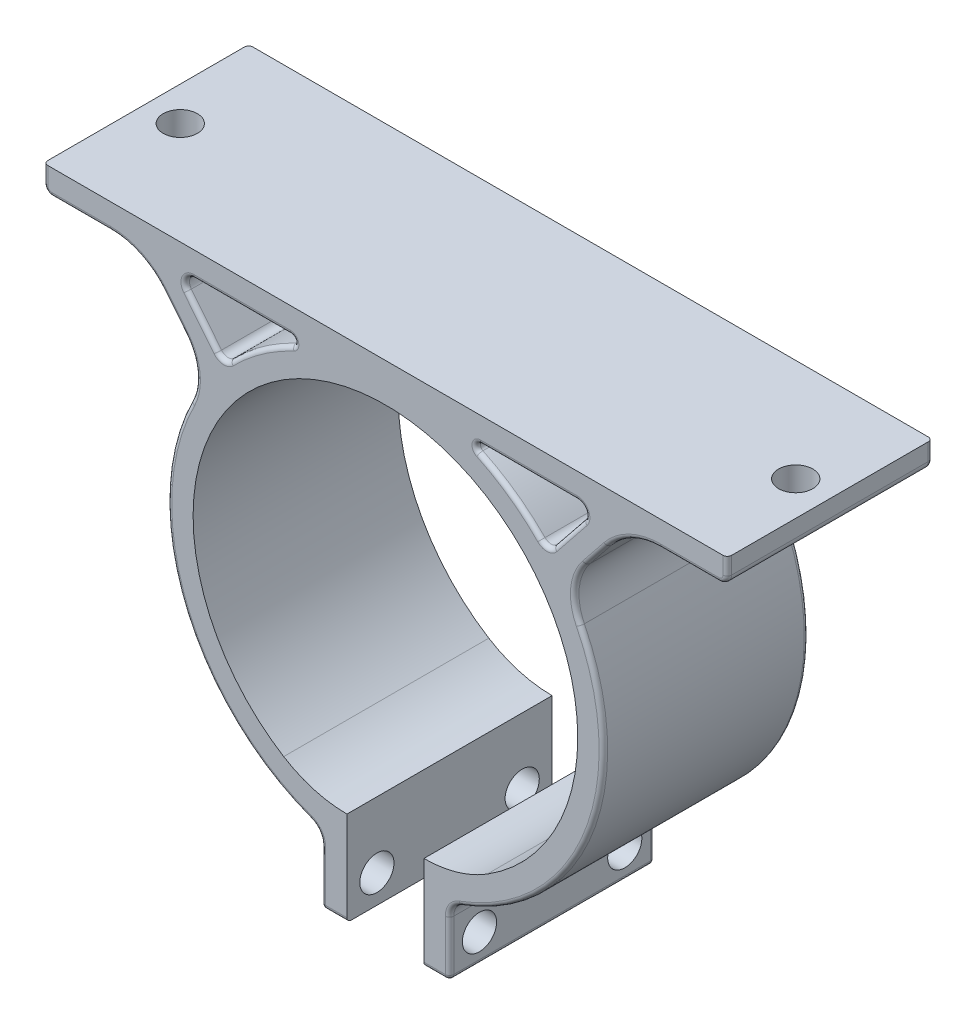
from build123d import *

# Parameters (mm, degrees)
SKIZZE1_R                       = 25.5
SKIZZE1_R_2                     = 22.5
AUFSATZ_LINEAR_AUSTRAGEN1_DEPTH = 24
SKIZZE2_W                       = 15
SKIZZE2_H                       = 10
SCHNITT_LINEAR_AUSTRAGEN3_DEPTH = 25
SKIZZE5_W                       = 80
SKIZZE5_H                       = 3
AUFSATZ_LINEAR_AUSTRAGEN2_DEPTH = 24
SKIZZE6_W                       = 3
SKIZZE6_H                       = 11
AUFSATZ_LINEAR_AUSTRAGEN3_DEPTH = 24
AUFSATZ_LINEAR_AUSTRAGEN4_DEPTH = 24
VERRUNDUNG3_R                   = 6
VERRUNDUNG4_R                   = 1
VERRUNDUNG5_R                   = 1
VERRUNDUNG6_R                   = 0.5
VERRUNDUNG11_R                  = 14
VERRUNDUNG12_R                  = 2
VERRUNDUNG13_R                  = 1
SKIZZE11_R                      = 2
SCHNITT_LINEAR_AUSTRAGEN4_DEPTH = 20
SKIZZE12_R                      = 2
SCHNITT_LINEAR_AUSTRAGEN5_DEPTH = 22
VERRUNDUNG14_R                  = 0.5
VERRUNDUNG15_R                  = 8
VERRUNDUNG16_R                  = 0.5
VERRUNDUNG17_R                  = 0.5


with BuildPart() as part:
    # Skizze1 → Aufsatz-Linear austragen1 (new body)
    with BuildSketch(Plane.XY.offset(10)):
        Circle(SKIZZE1_R)
        Circle(SKIZZE1_R_2, mode=Mode.SUBTRACT)
    extrude(amount=AUFSATZ_LINEAR_AUSTRAGEN1_DEPTH)

    # Skizze2 → Schnitt-Linear austragen3 (cut)
    with BuildSketch(Plane.XY.offset(10)):
        with Locations((0, -23.935185079)):
            Rectangle(SKIZZE2_W, SKIZZE2_H)
    extrude(amount=SCHNITT_LINEAR_AUSTRAGEN3_DEPTH, mode=Mode.SUBTRACT)

    # Skizze5 → Aufsatz-Linear austragen2 (add)
    with BuildSketch(Plane.XY.offset(10)):
        with Locations((0, 25.5)):
            Rectangle(SKIZZE5_W, SKIZZE5_H)
    extrude(amount=AUFSATZ_LINEAR_AUSTRAGEN2_DEPTH)

    # Skizze6 → Aufsatz-Linear austragen3 (add)
    with BuildSketch(Plane.XY.offset(10)):
        with Locations((6, -26.713203436)):
            Rectangle(SKIZZE6_W, SKIZZE6_H)
        with Locations((-6, -26.713203436)):
            Rectangle(SKIZZE6_W, SKIZZE6_H)
    extrude(amount=AUFSATZ_LINEAR_AUSTRAGEN3_DEPTH)

    # Skizze10 → Aufsatz-Linear austragen4 (add)
    with BuildSketch(Plane.XY.offset(10)):
        with BuildLine():
            Line((28.345283417, 24), (20.864493302, 14.660249631))
            ThreePointArc((20.864493302, 14.660249631), (18.945102255, 15.097259463), (18.947545893, 17.065769969))
            Line((18.947545893, 17.065769969), (24.501604344, 24))
            Line((24.501604344, 24), (28.345283417, 24))
        make_face()
        with BuildLine():
            Line((-24.501604344, 24), (-18.947545893, 17.065769969))
            ThreePointArc((-18.947545893, 17.065769969), (-18.945102255, 15.097259463), (-20.864493302, 14.660249631))
            Line((-20.864493302, 14.660249631), (-28.345283417, 24))
            Line((-28.345283417, 24), (-24.501604344, 24))
        make_face()
    extrude(amount=AUFSATZ_LINEAR_AUSTRAGEN4_DEPTH)

    # Verrundung3
    verrundung3_edges = [part.edges().sort_by_distance(p)[0] for p in [
        (-20.864493302, 14.660249631, 22),
        (20.864493302, 14.660249631, 22),
    ]]
    fillet(verrundung3_edges, radius=VERRUNDUNG3_R)

    # Verrundung4
    verrundung4_edges = [part.edges().sort_by_distance(p)[0] for p in [
        (-18.947545893, 17.065769969, 22),
        (18.947545893, 17.065769969, 22),
    ]]
    fillet(verrundung4_edges, radius=VERRUNDUNG4_R)

    # Verrundung5
    verrundung5_edges = [part.edges().sort_by_distance(p)[0] for p in [
        (-24.501604344, 24, 22),
        (24.501604344, 24, 22),
    ]]
    fillet(verrundung5_edges, radius=VERRUNDUNG5_R)

    # Verrundung6
    verrundung6_edges = [part.edges().sort_by_distance(p)[0] for p in [
        (-8.61684397, 24, 22),
        (8.61684397, 24, 22),
    ]]
    fillet(verrundung6_edges, radius=VERRUNDUNG6_R)

    # Verrundung11
    # the kernel refuses this fillet: 14 mm, written as the material it adds along each edge
    with BuildSketch(Plane(origin=(-7.5, -21.213203436, 34), x_dir=(-0.9010385119432196, 0.43373909207627176, 0), z_dir=(0, 0, -1))) as verrundung11_piece_1:
        with BuildLine():
            CenterArc((3.366195979, 13.917217345), VERRUNDUNG11_R, 244.308700365, 31.925166456)
            Line((-2.703115536, 1.301217276), (-2.824501766, 1.048897275))
            Line((-2.824501766, 1.048897275), (-0.121446946, -0.252290783))
            Line((-0.121446946, -0.252290783), (-0.030404351, -0.278344347))
            ThreePointArc((-0.030404351, -0.278344347), (2.443206759, -0.413043552), (4.916817868, -0.278344347))
            Line((4.916817868, -0.278344347), (4.886413517, 0))
        make_face()
    extrude(amount=24)
    with BuildSketch(Plane(origin=(7.5, -21.213203436, 34), x_dir=(-1, 0, 0), z_dir=(0, 0, -1))) as verrundung11_piece_2:
        with BuildLine():
            CenterArc((3.003369, 13.999999595), VERRUNDUNG11_R, 238.061045723, 31.925166456)
            Line((-4.402846764, 2.119428562), (-4.55097108, 1.881817142))
            ThreePointArc((-4.55097108, 1.881817142), (-2.380576517, 0.687546134), (-0.093333333, -0.263986532))
            Line((-0.093333333, -0.263986532), (0, -0.28))
            Line((0, -0.28), (2.99993262, -0.279999992))
            Line((2.99993262, -0.279999992), (3, 0))
        make_face()
    extrude(amount=24)

    # Verrundung12
    verrundung12_edges = [part.edges().sort_by_distance(p)[0] for p in [
        (-7.5, -24.372115214, 22),
        (7.5, -24.372115214, 22),
    ]]
    fillet(verrundung12_edges, radius=VERRUNDUNG12_R)

    # Verrundung13
    verrundung13_edges = [part.edges().sort_by_distance(p)[0] for p in [
        (-40, 24, 22),
        (40, 24, 22),
    ]]
    fillet(verrundung13_edges, radius=VERRUNDUNG13_R)

    # Skizze11 → Schnitt-Linear austragen4 (cut)
    with BuildSketch(Plane(origin=(0, 27, 0), x_dir=(1, 0, 0), z_dir=(0, 1, 0))):
        with Locations(Location((36, -22, 0), (0, 0, 180))):
            Circle(SKIZZE11_R)
        with Locations(Location((-36, -22, 0), (0, 0, 180))):
            Circle(SKIZZE11_R)
    extrude(amount=-SCHNITT_LINEAR_AUSTRAGEN4_DEPTH, mode=Mode.SUBTRACT)

    # Skizze12 → Schnitt-Linear austragen5 (cut)
    with BuildSketch(Plane.ZY.offset(7.5)):
        with Locations((13.5, -28.913203436)):
            Circle(SKIZZE12_R)
        with Locations((30.5, -28.913203436)):
            Circle(SKIZZE12_R)
    extrude(amount=-SCHNITT_LINEAR_AUSTRAGEN5_DEPTH, mode=Mode.SUBTRACT)

    # Verrundung14
    verrundung14_edges = [part.edges().sort_by_distance(p)[0] for p in [
        (7.5, -32.213203436, 22),
        (-7.5, -32.213203436, 22),
    ]]
    fillet(verrundung14_edges, radius=VERRUNDUNG14_R)

    # Verrundung15
    verrundung15_edges = [part.edges().sort_by_distance(p)[0] for p in [
        (-28.345283417, 24, 22),
        (28.345283417, 24, 22),
    ]]
    fillet(verrundung15_edges, radius=VERRUNDUNG15_R)

    # Verrundung16
    verrundung16_edges = [part.edges().sort_by_distance(p)[0] for p in [
        (-23.717650268, -9.366059244, 10),
        (-23.717650268, -9.366059244, 34),
        (24.701707347, 19.451003113, 10),
        (24.701707347, 19.451003113, 34),
        (-22.175925253, 14.777082644, 10),
        (-22.175925253, 14.777082644, 34),
        (22.175925253, 14.777082644, 10),
        (22.175925253, 14.777082644, 34),
        (-7.5, -28.760089618, 34),
        (-7.5, -28.760089618, 10),
        (23.717650268, -9.366059244, 10),
        (23.717650268, -9.366059244, 34),
        (-7.859600935, -24.662820694, 10),
        (-7.859600935, -24.662820694, 34),
        (7.859600935, -24.662820694, 34),
        (7.859600935, -24.662820694, 10),
        (-35.593697006, 24, 34),
        (-35.593697006, 24, 10),
        (40, 26, 10),
        (39.707106781, 24.292893219, 10),
        (-39.707106781, 24.292893219, 10),
        (40, 26, 34),
        (39.707106781, 24.292893219, 34),
        (-39.707106781, 24.292893219, 34),
        (-5.75, -32.213203436, 10),
        (-5.75, -32.213203436, 34),
        (7.5, -28.760089618, 10),
        (7.353553391, -32.066756826, 10),
        (-7.353553391, -32.066756826, 10),
        (7.5, -28.760089618, 34),
        (7.353553391, -32.066756826, 34),
        (-7.353553391, -32.066756826, 34),
        (35.593697006, 24, 10),
        (35.593697006, 24, 34),
        (-24.701707347, 19.451003113, 10),
        (-24.701707347, 19.451003113, 34),
        (28.723999262, 23.211442075, 10),
        (28.723999262, 23.211442075, 34),
        (-28.723999262, 23.211442075, 10),
        (-28.723999262, 23.211442075, 34),
        (-40, 26, 10),
        (-40, 26, 34),
        (5.75, -32.213203436, 10),
        (5.75, -32.213203436, 34),
    ]]
    fillet(verrundung16_edges, radius=VERRUNDUNG16_R)

    # Verrundung17
    verrundung17_edges = [part.edges().sort_by_distance(p)[0] for p in [
        (14.76918323, 20.787525748, 10),
        (14.76918323, 20.787525748, 34),
        (-21.433419249, 20.169377508, 10),
        (-21.433419249, 20.169377508, 34),
        (18.937464451, 17.590364754, 10),
        (18.937464451, 17.590364754, 34),
        (-18.937464451, 17.590364754, 10),
        (-18.937464451, 17.590364754, 34),
        (-16.771856592, 24, 10),
        (-16.771856592, 24, 34),
        (21.433419249, 20.169377508, 10),
        (21.433419249, 20.169377508, 34),
        (-23.320845712, 23.432924344, 10),
        (-23.320845712, 23.432924344, 34),
        (23.320845712, 23.432924344, 10),
        (23.320845712, 23.432924344, 34),
        (-14.76918323, 20.787525748, 10),
        (-14.76918323, 20.787525748, 34),
        (16.771856592, 24, 10),
        (16.771856592, 24, 34),
        (-10.636465004, 23.609632252, 34),
        (-10.636465004, 23.609632252, 10),
        (10.636465004, 23.609632252, 10),
        (10.636465004, 23.609632252, 34),
    ]]
    fillet(verrundung17_edges, radius=VERRUNDUNG17_R)


solid = part.part
